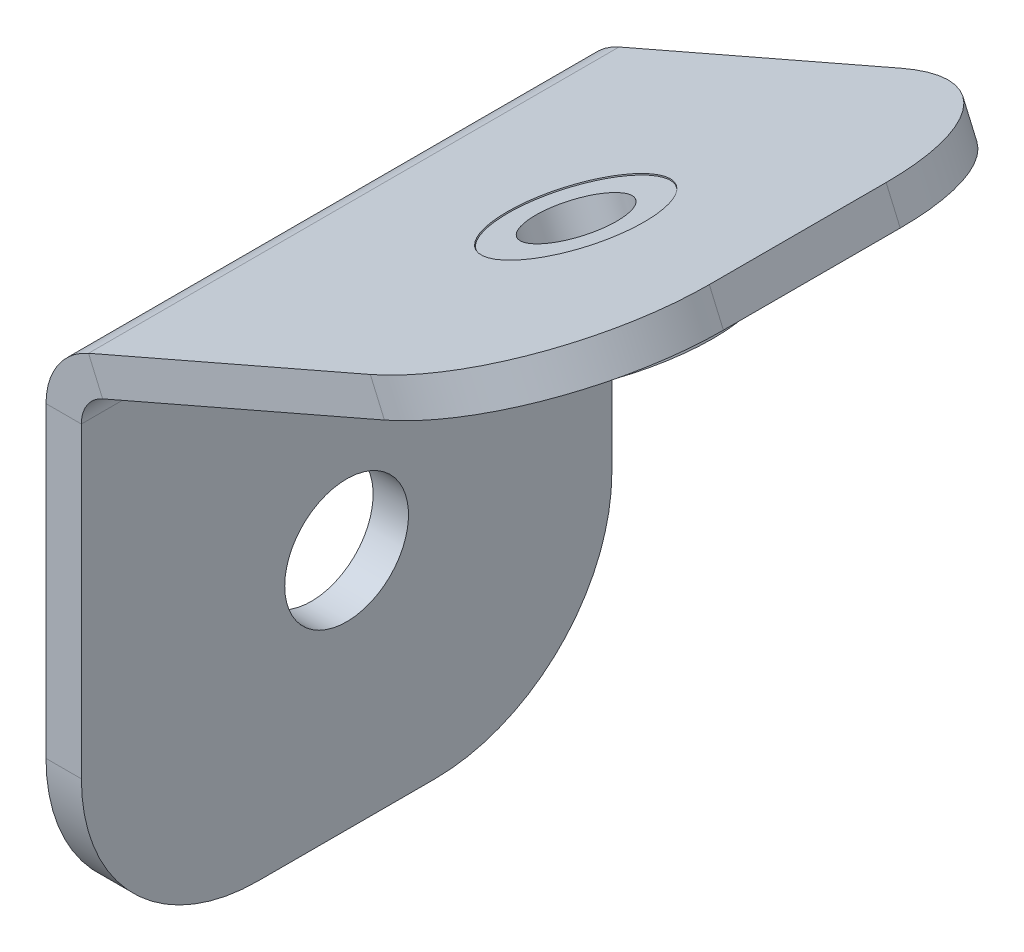
from build123d import *

# Parameters (mm, degrees)
BRIDA_BASE1_DEPTH          = 15
CORTAR_EXTRUIR1_REACH      = 29.746
CROQUIS2_R                 = 2.11
CORTAR_EXTRUIR2_REACH      = 31.421
CROQUIS3_R                 = 1.75
REDONDEO1_R                = 5
S_M3_1_START               = 12.855392961
S_M3_1_OUTLINE_R           = 3.15
S_M3_1_OUTLINE_R_2         = 1.25
S_M3_1_DEPTH               = 1.5
S_M3_1_START_2             = 11.885392961
S_M3_1_2_OUTLINE_R         = 2.1
S_M3_1_2_OUTLINE_R_2       = 1.25
S_M3_1_2_DEPTH             = 0.97
S_LIDO_MOVER_COPIAR2_ANGLE = 156.5


with BuildPart() as part:
    # Brida base1: sheet metal written as solids
    # Croquis1 → Brida base1 (new body)
    with BuildSketch(Plane.XY):
        with BuildLine():
            Line((0, 0), (0, 13.688742542))
            ThreePointArc((0, 13.688742542), (0.327427688, 14.785329001), (1.202501862, 15.522862691))
            Line((1.202501862, 15.522862691), (13.755901116, 20.981236034))
            Line((13.755901116, 20.981236034), (14.154650185, 20.064175959))
            Line((14.154650185, 20.064175959), (1.601250931, 14.605802616))
            ThreePointArc((1.601250931, 14.605802616), (1.163713844, 14.237035771), (1, 13.688742542))
            Line((1, 13.688742542), (1, 0))
            Line((1, 0), (0, 0))
        make_face()
    extrude(amount=BRIDA_BASE1_DEPTH)

    # Croquis2 → Cortar-Extruir1 (cut, up to next)
    with BuildSketch(Plane(origin=(-5.485152762, 12.6149877, 0), x_dir=(0.917060074385125, 0.3987490689252439, 0), z_dir=(-0.3987490689252439, 0.917060074385125, 0)), mode=Mode.PRIVATE) as cortar_extruir1_sk1:
        with Locations(Location((14.136864763, -7.5, 0), (0, 0, 180))):
            Circle(CROQUIS2_R)
    cortar_extruir1_tool1 = extrude(cortar_extruir1_sk1.sketch, amount=-CORTAR_EXTRUIR1_REACH, mode=Mode.PRIVATE) & part.part
    add(cortar_extruir1_tool1.solids().sort_by_distance((7.479201, 18.252049, 7.5))[0], mode=Mode.SUBTRACT)

    # Croquis3 → Cortar-Extruir2 (cut, up to next)
    with BuildSketch(Plane.ZY, mode=Mode.PRIVATE) as cortar_extruir2_sk1:
        with Locations((7.5, 6.844371271)):
            Circle(CROQUIS3_R)
    cortar_extruir2_tool1 = extrude(cortar_extruir2_sk1.sketch, amount=-CORTAR_EXTRUIR2_REACH, mode=Mode.PRIVATE) & part.part
    add(cortar_extruir2_tool1.solids().sort_by_distance((0, 6.844371, 7.5))[0], mode=Mode.SUBTRACT)

    # Redondeo1
    redondeo1_edges = [part.edges().sort_by_distance(p)[0] for p in [
        (0.5, 0, 15),
        (13.95527565, 20.522705997, 15),
        (0.5, 0, 0),
        (13.95527565, 20.522705997, 0),
    ]]
    fillet(redondeo1_edges, radius=REDONDEO1_R)


with BuildPart() as body_2:
    # S-M3-1: read off the stored shape, not the designer's step
    # S-M3-1 outline → S-M3-1 (new body)
    with BuildSketch(Plane(origin=(0, 0, 0), x_dir=(1, 0, 0), z_dir=(0, 1, 0)).offset(S_M3_1_START)):
        with Locations((7.761578354, 3.940203324)):
            Circle(S_M3_1_OUTLINE_R)
        with Locations((7.761578354, 3.940203324)):
            Circle(S_M3_1_OUTLINE_R_2, mode=Mode.SUBTRACT)
    extrude(amount=S_M3_1_DEPTH)

    # S-M3-1 2 outline → S-M3-1 2 (add)
    with BuildSketch(Plane(origin=(0, 0, 0), x_dir=(1, 0, 0), z_dir=(0, 1, 0)).offset(S_M3_1_START_2)):
        with Locations((7.761578354, 3.940203324)):
            Circle(S_M3_1_2_OUTLINE_R)
        with Locations((7.761578354, 3.940203324)):
            Circle(S_M3_1_2_OUTLINE_R_2, mode=Mode.SUBTRACT)
    extrude(amount=S_M3_1_2_DEPTH)


with BuildPart() as body_2_1:
    # Sólido-Mover/Copiar2: read off the stored shape, not the designer's step
    # Sólido-Mover/Copiar2: moved
    add(body_2.part.moved(Location((-21.8984431, -25.6112941, 11.4402033))).rotate(Axis((0, 0, 0), (0, 0, -1)), S_LIDO_MOVER_COPIAR2_ANGLE))


solid = Compound([part.part, body_2_1.part])
